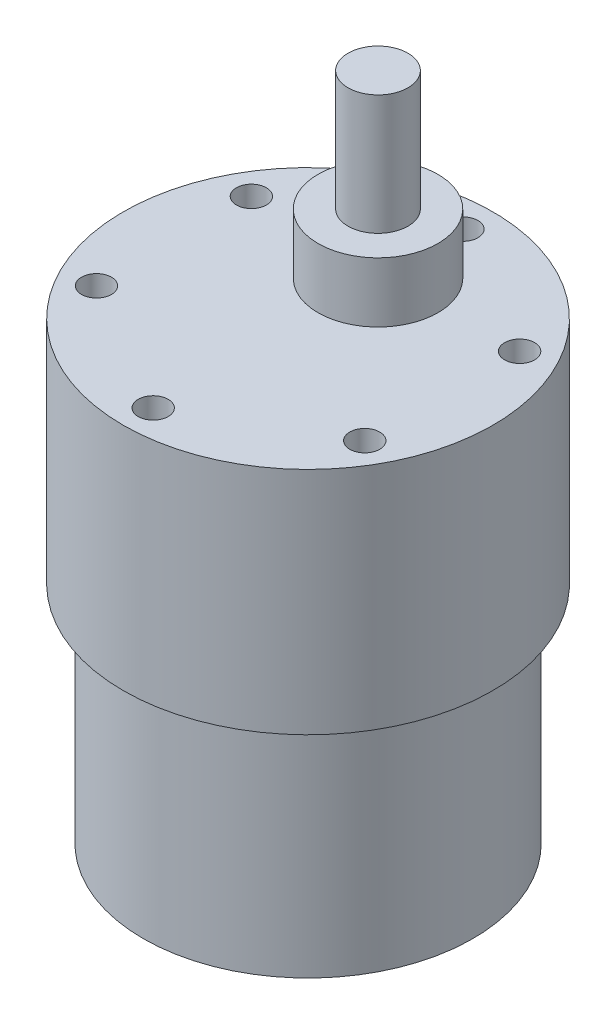
from build123d import *

# Parameters (mm, degrees)
SKETCH_1_R          = 18.5
EXTRUDE_1_DEPTH     = 23
SKETCH_3_R          = 16.5
EXTRUDE_2_DEPTH     = 22.5
SKETCH_4_R          = 1.5
CUT_EXTRUDE_1_DEPTH = 15
SKETCH_5_R          = 6
EXTRUDE_3_DEPTH     = 6
SKETCH_6_R          = 3
EXTRUDE_4_DEPTH     = 12
SKETCH_7_R          = 7
EXTRUDE_5_DEPTH     = 6.2


with BuildPart() as part:
    # 草图1 → 凸台-拉伸1 (new body)
    with BuildSketch(Plane(origin=(0, 0, 0), x_dir=(1, 0, 0), z_dir=(0, 1, 0))):
        Circle(SKETCH_1_R)
    extrude(amount=-EXTRUDE_1_DEPTH)

    # 草图3 → 凸台-拉伸2 (add)
    with BuildSketch(Plane.XZ.offset(23)):
        Circle(SKETCH_3_R)
    extrude(amount=EXTRUDE_2_DEPTH)

    # 草图4 → 切除-拉伸1 (cut)
    with BuildSketch(Plane(origin=(0, 0, 0), x_dir=(1, 0, 0), z_dir=(0, 1, 0))):
        with Locations((0, 15.5)):
            Circle(SKETCH_4_R)
        with Locations((13.423393759, 7.75)):
            Circle(SKETCH_4_R)
        with Locations((13.423393759, -7.75)):
            Circle(SKETCH_4_R)
        with Locations((0, -15.5)):
            Circle(SKETCH_4_R)
        with Locations((-13.423393759, -7.75)):
            Circle(SKETCH_4_R)
        with Locations((-13.423393759, 7.75)):
            Circle(SKETCH_4_R)
    extrude(amount=-CUT_EXTRUDE_1_DEPTH, mode=Mode.SUBTRACT)

    # 草图5 → 凸台-拉伸3 (add)
    with BuildSketch(Plane(origin=(0, 0, 0), x_dir=(1, 0, 0), z_dir=(0, 1, 0))):
        with Locations((0, 7)):
            Circle(SKETCH_5_R)
    extrude(amount=EXTRUDE_3_DEPTH)

    # 草图6 → 凸台-拉伸4 (add)
    with BuildSketch(Plane(origin=(0, 6, 0), x_dir=(1, 0, 0), z_dir=(0, 1, 0))):
        with Locations((0, 7)):
            Circle(SKETCH_6_R)
    extrude(amount=EXTRUDE_4_DEPTH)

    # 草图7 → 凸台-拉伸5 (add)
    with BuildSketch(Plane.XZ.offset(45.5)):
        Circle(SKETCH_7_R)
    extrude(amount=EXTRUDE_5_DEPTH)


solid = part.part
